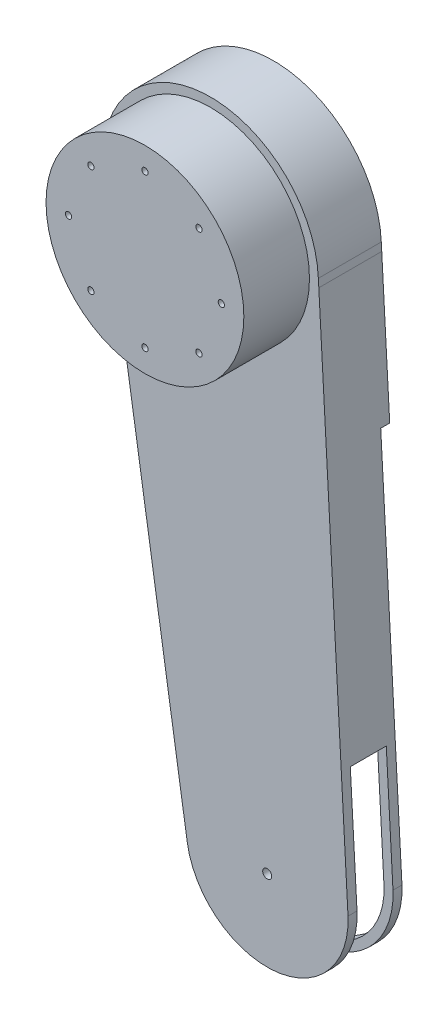
from build123d import *
from build123d.topology import SkipClean

# Parameters (mm, degrees)
EXTRUDE_1_DEPTH      = 30
SKETCH_2_R           = 55
EXTRUDE_2_DEPTH      = 36.5
SHELL_4_DEPTH        = 25
SHELL_START          = 25
SHELL_4_2_OUTLINE_R  = 50
SHELL_4_2_DEPTH      = 36.5
SKETCH_3_W           = 20
SKETCH_3_H           = 111
CUT_EXTRUDE_2_DEPTH  = 500
SKETCH_4_R           = 2.5
CUT_EXTRUDE_4_DEPTH  = 355.19861062
SKETCH_5_R           = 1.75
CUT_EXTRUDE_5_DEPTH  = 358.094743401
EXTRUDE_START        = 5
EXTRUDE_3_DEPTH      = 5
SKETCH_12_R          = 50
EXTRUDE_4_DEPTH      = 5
SKETCH_13_R          = 2
CUT_EXTRUDE_10_DEPTH = 5


# Read off the part's stored shape, not the designer's step: 抽壳4
with BuildPart() as part:
    # 草图1 → 凸台-拉伸1 (new body)
    with BuildSketch(Plane.XY):
        with BuildLine():
            Line((-58.937975667, -11.238995696), (-58.491161057, -14.310445119))
            Line((-58.491161057, -14.310445119), (-12.976113652, -305.2975933))
            ThreePointArc((-12.976113652, -305.2975933), (35.99310733, -343.116877228), (76.436495207, -296.291507849))
            Line((76.436495207, -296.291507849), (60.189812793, -1.786392218))
            ThreePointArc((60.189812793, -1.786392218), (60.066392408, 0.434720965), (59.941196791, 2.655734793))
            ThreePointArc((59.941196791, 2.655734793), (-6.965450237, 59.594316029), (-58.937975667, -11.238995696))
        make_face()
    extrude(amount=EXTRUDE_1_DEPTH)

    # 草图2 → 凸台-拉伸2 (add)
    with BuildSketch(Plane.XY.offset(30)):
        Circle(SKETCH_2_R)
    extrude(amount=EXTRUDE_2_DEPTH)

    # 抽壳4 outline → 抽壳4 (cut)
    with BuildSketch(Plane.XY):
        with BuildLine():
            Line((-53.547092666, -13.564185688), (-8.036178628, -304.524908395))
            ThreePointArc((-8.036178628, -304.524908395), (35.480554819, -338.143202606), (71.442739942, -296.542517074))
            Line((71.442739942, -296.542517074), (55.197403703, -2.061803682))
            ThreePointArc((55.197403703, -2.061803682), (55.073318105, 0.171165742), (54.947435043, 2.404034556))
            ThreePointArc((54.947435043, 2.404034556), (-6.423300224, 54.623632379), (-54.006228237, -10.408040718))
            Line((-54.006228237, -10.408040718), (-53.547092666, -13.564185688))
        make_face()
    extrude(amount=SHELL_4_DEPTH, mode=Mode.SUBTRACT)

    # Shell 4 2 outline → Shell 4 2 (cut)
    with BuildSketch(Plane.XY.offset(SHELL_START)):
        Circle(SHELL_4_2_OUTLINE_R)
    extrude(amount=SHELL_4_2_DEPTH, mode=Mode.SUBTRACT)

    # 草图3 → 切除-拉伸2 (cut, symmetric)
    with BuildSketch(Plane(origin=(0, 0, 0), x_dir=(0, 0, -1), z_dir=(1, 0, 0))):
        with Locations((-15, -284.205905552)):
            Rectangle(SKETCH_3_W, SKETCH_3_H)
    extrude(amount=CUT_EXTRUDE_2_DEPTH, both=True, mode=Mode.SUBTRACT)

    # 草图4 → 切除-拉伸4 (cut, through all)
    with BuildSketch(Plane(origin=(0, 0, 25), x_dir=(-1, 0, 0), z_dir=(0, 0, -1))):
        with Locations((-31.483301561, -298.34342916)):
            Circle(SKETCH_4_R)
    extrude(amount=-CUT_EXTRUDE_4_DEPTH, mode=Mode.SUBTRACT)

    # 草图5 → 切除-拉伸5 (cut, through all)
    with BuildSketch(Plane(origin=(0, 0, 61.5), x_dir=(-1, 0, 0), z_dir=(0, 0, -1))):
        with Locations((-42.5, 0)):
            Circle(SKETCH_5_R)
        with Locations((-30.0520382, 30.0520382)):
            Circle(SKETCH_5_R)
        with Locations((0, 42.5)):
            Circle(SKETCH_5_R)
        with Locations((30.0520382, 30.0520382)):
            Circle(SKETCH_5_R)
        with Locations((42.5, 0)):
            Circle(SKETCH_5_R)
        with Locations((30.0520382, -30.0520382)):
            Circle(SKETCH_5_R)
        with Locations((0, -42.5)):
            Circle(SKETCH_5_R)
        with Locations((-30.0520382, -30.0520382)):
            Circle(SKETCH_5_R)
    extrude(amount=-CUT_EXTRUDE_5_DEPTH, mode=Mode.SUBTRACT)

    # 草图11 → 凸台-拉伸3 (add)
    with SkipClean():  # the faces are left unmerged after this step: merging them gives an invalid solid
        with BuildSketch(Plane(origin=(0, 0, 0), x_dir=(-1, 0, 0), z_dir=(0, 0, -1)).offset(EXTRUDE_START)):
            with BuildLine():
                Line((-64.626874789, -82.217425636), (45.182822013, -99.393419788))
                Line((45.182822013, -99.393419788), (58.491161057, -14.310445119))
                Line((58.491161057, -14.310445119), (58.937975667, -11.238995696))
                ThreePointArc((58.937975667, -11.238995696), (6.965450237, 59.594316029), (-59.941196791, 2.655734793))
                ThreePointArc((-59.941196791, 2.655734793), (-60.066392408, 0.434720965), (-60.189812793, -1.786392218))
                Line((-60.189812793, -1.786392218), (-64.626874789, -82.217425636))
            make_face()
        extrude(amount=-EXTRUDE_3_DEPTH)

    # 草图12 → 凸台-拉伸4 (add)
    with SkipClean():  # the faces are left unmerged after this step: merging them gives an invalid solid
        with BuildSketch(Plane(origin=(0, 0, -5), x_dir=(-1, 0, 0), z_dir=(0, 0, -1)).offset(EXTRUDE_START)):
            with Locations(Location((0, 0, 0), (0, 0, 180))):
                Circle(SKETCH_12_R)
        extrude(amount=-EXTRUDE_4_DEPTH)

    # 草图13 → 切除-拉伸10 (cut)
    with SkipClean():  # the faces are left unmerged after this step: merging them gives an invalid solid
        with BuildSketch(Plane(origin=(0, 0, -10), x_dir=(-1, 0, 0), z_dir=(0, 0, -1))):
            with Locations((17.25, 0)):
                Circle(SKETCH_13_R)
            with Locations((8.625, -14.938938215)):
                Circle(SKETCH_13_R)
            with Locations((-8.625, -14.938938215)):
                Circle(SKETCH_13_R)
            with Locations((-17.25, 0)):
                Circle(SKETCH_13_R)
            with Locations((-8.625, 14.938938215)):
                Circle(SKETCH_13_R)
            with Locations((8.625, 14.938938215)):
                Circle(SKETCH_13_R)
        extrude(amount=-CUT_EXTRUDE_10_DEPTH, mode=Mode.SUBTRACT)


solid = part.part
